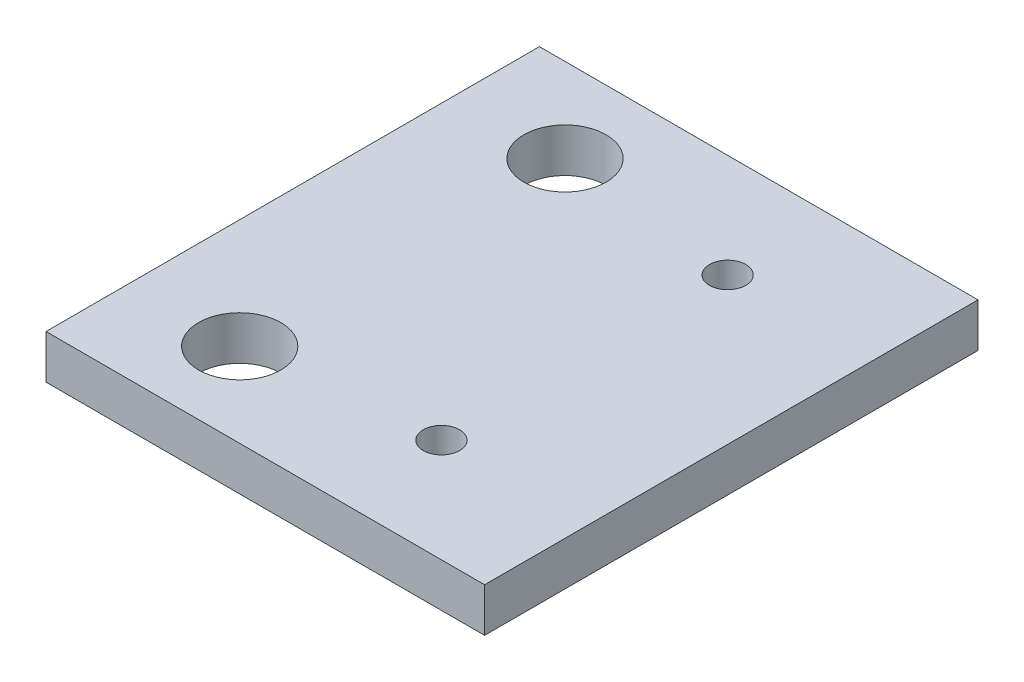
from build123d import *

# Parameters (mm, degrees)
SKETCH1_W           = 50.8
SKETCH1_H           = 57.15
BOSS_EXTRUDE1_DEPTH = 5.08
SKETCH2_R           = 4.7625
CUT_EXTRUDE1_DEPTH  = 5.08
SKETCH3_R           = 2.1
CUT_EXTRUDE3_DEPTH  = 39.568082983


with BuildPart() as part:
    # Sketch1 → Boss-Extrude1 (new body)
    with BuildSketch(Plane(origin=(0, 0, 0), x_dir=(1, 0, 0), z_dir=(0, 1, 0))):
        Rectangle(SKETCH1_W, SKETCH1_H)
    extrude(amount=BOSS_EXTRUDE1_DEPTH)

    # Sketch2 → Cut-Extrude1 (cut)
    with BuildSketch(Plane(origin=(0, 5.08, 0), x_dir=(1, 0, 0), z_dir=(0, 1, 0))):
        with Locations((-12.7, 18.837656)):
            Circle(SKETCH2_R)
        with Locations((-12.7, -18.837656)):
            Circle(SKETCH2_R)
    extrude(amount=-CUT_EXTRUDE1_DEPTH, mode=Mode.SUBTRACT)

    # Sketch3 → Cut-Extrude3 (cut, through all)
    with BuildSketch(Plane.XZ):
        with Locations((8.4, -16.575)):
            Circle(SKETCH3_R)
        with Locations((8.4, 16.575)):
            Circle(SKETCH3_R)
    extrude(amount=-CUT_EXTRUDE3_DEPTH, mode=Mode.SUBTRACT)


solid = part.part
